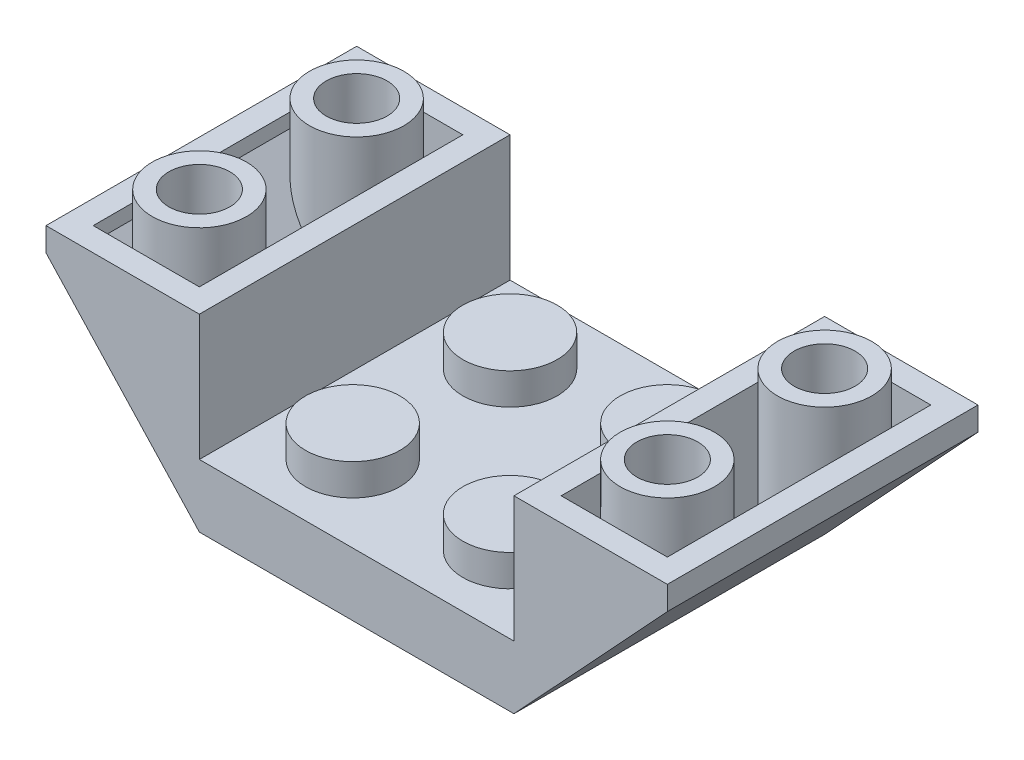
from build123d import *

# Parameters (mm, degrees)
SKETCH1_W                       = 16
SKETCH1_H                       = 3.2
BOSS_EXTRUDE1_DEPTH             = 15.8
SKETCH2_R                       = 2.4
BOSS_EXTRUDE2_DEPTH             = 1.6
LPATTERN1_COUNT                 = 2
LPATTERN1_PITCH                 = 8
LPATTERN1_COUNT_DIR2            = 6
LPATTERN1_PITCH_DIR2            = 8
SHELL1_T                        = -1.2
SKETCH3_R                       = 3.25
SKETCH3_R_2                     = 2.4
BOSS_EXTRUDE3_DEPTH             = 1.8
SHELL2_START                    = -14.6
SHELL2_DEPTH                    = 13.4
BOSS_EXTRUDE4_REACH             = 32.137
SKETCH11_R                      = 2.4
SKETCH11_R_2                    = 1.55
BOSS_EXTRUDE4_DIRECTION_2_DEPTH = 1.6
SHELL6_T                        = -1.2


# Read off the part's stored shape, not the designer's step: Shell2
with BuildPart() as part:
    # Sketch1 → Boss-Extrude1 (new body)
    with BuildSketch(Plane.XY):
        with Locations((8, 1.6)):
            Rectangle(SKETCH1_W, SKETCH1_H)
    extrude(amount=-BOSS_EXTRUDE1_DEPTH)

    # Sketch2 → Boss-Extrude2 (add)
    with BuildSketch(Plane(origin=(0, 3.2, 0), x_dir=(1, 0, 0), z_dir=(0, 1, 0))):
        with Locations(Location((3.9, 3.9, 0), (0, 0, 270))):
            Circle(SKETCH2_R)
    boss_extrude2 = extrude(amount=BOSS_EXTRUDE2_DEPTH)

    # LPattern1: Boss-Extrude2 2 × 6, 8 skipped
    with Locations(*[(j * LPATTERN1_PITCH_DIR2, 0, -i * LPATTERN1_PITCH) for i in range(LPATTERN1_COUNT) for j in range(LPATTERN1_COUNT_DIR2) if (i, j) not in ((0, 0), (0, 2), (0, 3), (0, 4), (0, 5), (1, 2), (1, 3), (1, 4), (1, 5))]):
        add(boss_extrude2)

    # Shell1
    shell1_openings = [part.faces().sort_by_distance(p)[0] for p in [
        (8, 0, -7.9),
    ]]
    offset(amount=SHELL1_T, openings=shell1_openings, kind=Kind.INTERSECTION)

    # Sketch3 → Boss-Extrude3 (add)
    with BuildSketch(Plane.XZ.offset(-2)):
        with Locations(Location((7.9, -7.9, 0), (0, 0, 90))):
            Circle(SKETCH3_R)
        with Locations(Location((7.9, -7.9, 0), (0, 0, 270))):
            Circle(SKETCH3_R_2, mode=Mode.SUBTRACT)
    extrude(amount=BOSS_EXTRUDE3_DEPTH)

    # Sketch7 → Loft1 section 0
    with BuildSketch(Plane(origin=(23.8, 0, 0), x_dir=(0, 0, -1), z_dir=(1, 0, 0))):
        with BuildLine():
            Line((15.8, 9.6), (15.8, 8.4))
            Line((15.8, 8.4), (0, 8.4))
            Line((0, 8.4), (0, 9.6))
            Line((0, 9.6), (15.8, 9.6))
        make_face()
    # Sketch5 → Loft1 section 1
    with BuildSketch(Plane(origin=(16, 0, 0), x_dir=(0, 0, -1), z_dir=(1, 0, 0))):
        with BuildLine():
            Line((0, 0), (0, 9.6))
            Line((0, 9.6), (15.8, 9.6))
            Line((15.8, 9.6), (15.8, 0))
            Line((15.8, 0), (0, 0))
        make_face()
    loft1 = loft()

    # Shell2 outline → Shell2 (cut)
    with BuildSketch(Plane.XY.offset(SHELL2_START)):
        Polygon((16, 1.763535985), (16.219573728, 2), (16, 2), align=None)
        Polygon((17.2, 9.6), (17.2, 3.055843678), (22.6, 8.871228293), (22.6, 9.6), align=None)
    extrude(amount=SHELL2_DEPTH, mode=Mode.SUBTRACT)

    # Sketch11 → Boss-Extrude4 (add, up to next)
    with BuildSketch(Plane(origin=(0, 9.6, 0), x_dir=(1, 0, 0), z_dir=(0, 1, 0)), mode=Mode.PRIVATE) as boss_extrude4_sk1:
        with Locations(Location((19.9, 11.9, 0), (0, 0, 180))):
            Circle(SKETCH11_R)
        with Locations((19.9, 11.9)):
            Circle(SKETCH11_R_2, mode=Mode.SUBTRACT)
    boss_extrude4_tool1 = extrude(boss_extrude4_sk1.sketch, amount=-BOSS_EXTRUDE4_REACH, mode=Mode.PRIVATE) - part.part
    # Sketch11 → Boss-Extrude4 (add, up to next)
    with BuildSketch(Plane(origin=(0, 9.6, 0), x_dir=(1, 0, 0), z_dir=(0, 1, 0)), mode=Mode.PRIVATE) as boss_extrude4_sk2:
        with Locations(Location((19.9, 3.9, 0), (0, 0, 180))):
            Circle(SKETCH11_R)
        with Locations((19.9, 3.9)):
            Circle(SKETCH11_R_2, mode=Mode.SUBTRACT)
    boss_extrude4_tool2 = extrude(boss_extrude4_sk2.sketch, amount=-BOSS_EXTRUDE4_REACH, mode=Mode.PRIVATE) - part.part
    boss_extrude4_1 = boss_extrude4_tool1.solids().sort_by_distance((22.232118, 9.6, -11.9))[0]
    add(boss_extrude4_1)
    boss_extrude4_2 = boss_extrude4_tool2.solids().sort_by_distance((22.232118, 9.6, -3.9))[0]
    add(boss_extrude4_2)
    boss_extrude4 = boss_extrude4_1 + boss_extrude4_2  # Boss-Extrude4 as one shape, for the pattern or mirror that repeats it

    # Sketch11 → Boss-Extrude4 direction 2 (add)
    # profile 1 of 2: a face of its own
    with BuildSketch(Plane(origin=(0, 9.6, 0), x_dir=(1, 0, 0), z_dir=(0, 1, 0))):
        with Locations(Location((19.9, 11.9, 0), (0, 0, 180))):
            Circle(SKETCH11_R)
        with Locations((19.9, 11.9)):
            Circle(SKETCH11_R_2, mode=Mode.SUBTRACT)
    # profile 2 of 2: a face of its own
    with BuildSketch(Plane(origin=(0, 9.6, 0), x_dir=(1, 0, 0), z_dir=(0, 1, 0))):
        with Locations(Location((19.9, 3.9, 0), (0, 0, 180))):
            Circle(SKETCH11_R)
        with Locations((19.9, 3.9)):
            Circle(SKETCH11_R_2, mode=Mode.SUBTRACT)
    boss_extrude4_direction_2 = extrude(amount=BOSS_EXTRUDE4_DIRECTION_2_DEPTH)

    # Mirror1: Loft1 across plane
    add(loft1.mirror(Plane(origin=(8, 0, 0), x_dir=(0, 0, 1), z_dir=(1, 0, 0))))


with BuildPart() as body_2:
    # Split1: the piece on the far side of the plane
    add(part.part)
    split(bisect_by=Plane(origin=(0, 0, 0), x_dir=(0, 0, 1), z_dir=(1, 0, 0)), keep=Keep.BOTTOM)

    # Shell6
    shell6_openings = [body_2.faces().sort_by_distance(p)[0] for p in [
        (-3.9, 9.6, -7.9),
    ]]
    offset(amount=SHELL6_T, openings=shell6_openings, kind=Kind.INTERSECTION)


with BuildPart() as part_1:
    add(part.part)

    # Split1
    split(bisect_by=Plane(origin=(0, 0, 0), x_dir=(0, 0, 1), z_dir=(1, 0, 0)), keep=Keep.TOP)


with BuildPart() as body_2_1:
    add(body_2.part)

    # Combine1: union part
    add(part_1.part)

    # Mirror4: Boss-Extrude4, Boss-Extrude4 direction 2 across plane
    add(boss_extrude4.mirror(Plane(origin=(8, 0, 0), x_dir=(0, 0, 1), z_dir=(1, 0, 0))))
    add(boss_extrude4_direction_2.mirror(Plane(origin=(8, 0, 0), x_dir=(0, 0, 1), z_dir=(1, 0, 0))))


solid = body_2_1.part
